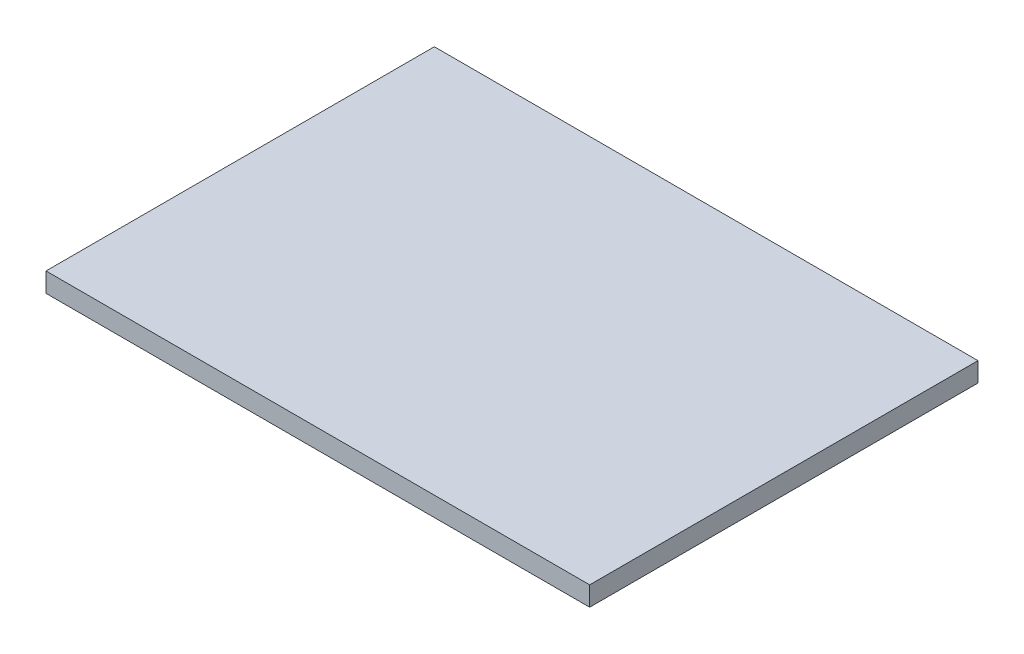
from build123d import *

# Parameters (mm, degrees)
SKETCH1_W           = 711.2
SKETCH1_H           = 508
BOSS_EXTRUDE1_DEPTH = 25.4


with BuildPart() as part:
    # Sketch1 → Boss-Extrude1 (new body)
    with BuildSketch(Plane(origin=(0, 0, 0), x_dir=(1, 0, 0), z_dir=(0, 1, 0))):
        with Locations((355.6, 508)):
            Rectangle(SKETCH1_W, SKETCH1_H)
    extrude(amount=BOSS_EXTRUDE1_DEPTH)


solid = part.part
